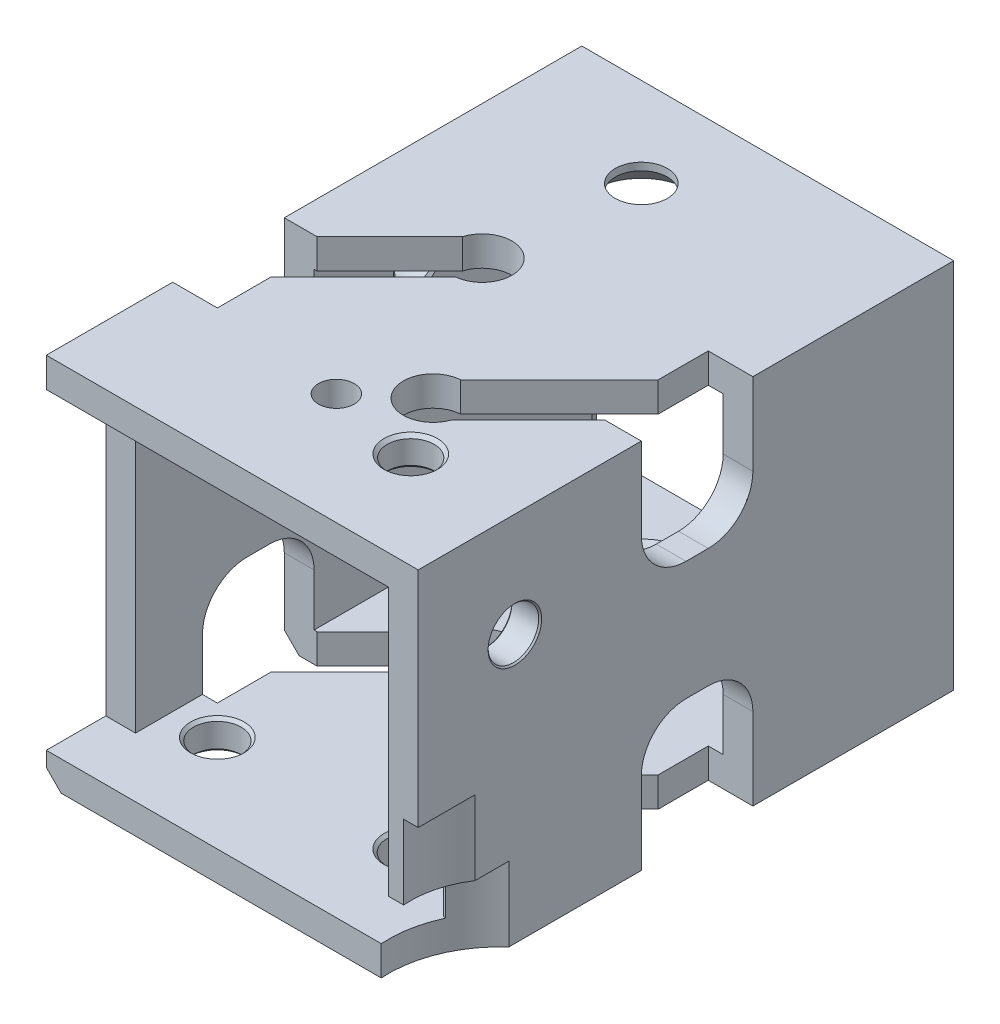
from build123d import *

# Parameters (mm, degrees)
SKETCH_1_W                   = 25
SKETCH_1_H                   = 25
SKETCH_1_W_2                 = 21
SKETCH_1_H_2                 = 21
EXTRUDE_1_DEPTH              = 36
SKETCH_11_R                  = 2
CUT_EXTRUDE_3_DEPTH          = 7
CUT_EXTRUDE_START            = -19
SKETCH_11_3_R                = 2
CUT_EXTRUDE_11_DEPTH         = 32.457903246
CHAMFER_2_SIZE               = 1
CHAMFER_4_SIZE               = 1
CHAMFER_4_SIZE2              = 1.327044822
SKETCH_14_R                  = 7.5
CUT_EXTRUDE_6_DEPTH          = 5
CHAMFER_5_SIZE               = 0.5
CUT_EXTRUDE_8_DEPTH          = 50.497474683
HOLE_WIZARD_3_2_AT_2_COUNT   = 2
HOLE_WIZARD_3_2_AT_2_PITCH   = 13
HOLE_WIZARD_4_401_AT_2_COUNT = 2
HOLE_WIZARD_4_401_AT_2_PITCH = 16
CUT_EXTRUDE_13_DEPTH         = 3
CUT_EXTRUDE_14_DEPTH         = 3
SKETCH_25_R                  = 1.75
CUT_EXTRUDE_15_DEPTH         = 51.457903246
SKETCH_26_R                  = 6
CUT_EXTRUDE_16_DEPTH         = 5
CHAMFER_6_SIZE               = 1.5


with BuildPart() as part:
    # Эскиз1 → Вытянуть1 (new body)
    with BuildSketch(Plane.XY):
        with Locations((12.5, 12.5)):
            Rectangle(SKETCH_1_W, SKETCH_1_H)
        with Locations((12.5, 12.5)):
            Rectangle(SKETCH_1_W_2, SKETCH_1_H_2, mode=Mode.SUBTRACT)
    extrude(amount=EXTRUDE_1_DEPTH)

    # Эскиз11 → Вырез-Вытянуть3 (cut)
    with BuildSketch(Plane(origin=(0, 25, 0), x_dir=(1, 0, 0), z_dir=(0, 1, 0))):
        with BuildLine():
            Line((25, -18.52949345), (25, -13.862588694))
            Line((25, -13.862588694), (15.357506109, -23.505082585))
            ThreePointArc((15.357506109, -23.505082585), (16.862903558, -24.03627397), (17.5, -25.5))
            ThreePointArc((17.5, -25.5), (17.47421651, -25.820108062), (17.397530829, -26.131962621))
            Line((17.397530829, -26.131962621), (25, -18.52949345))
        make_face()
        with BuildLine():
            Line((7.087167948, -15.115984981), (0, -22.203152929))
            Line((0, -22.203152929), (0, -26.870057685))
            Line((0, -26.870057685), (9.177993887, -17.692063798))
            ThreePointArc((9.177993887, -17.692063798), (7.447111922, -16.960372412), (7.087167948, -15.115984981))
        make_face()
        with Locations((9, -15.7)):
            Circle(SKETCH_11_R)
        with Locations((15.5, -25.5)):
            Circle(SKETCH_11_R)
    extrude(amount=-CUT_EXTRUDE_3_DEPTH, mode=Mode.SUBTRACT)

    # Эскиз11<3> → Вырез-Вытянуть11 (cut, through all)
    with BuildSketch(Plane(origin=(0, 25, 0), x_dir=(1, 0, 0), z_dir=(0, 1, 0)).offset(CUT_EXTRUDE_START)):
        with BuildLine():
            Line((25, -18.52949345), (25, -13.862588694))
            Line((25, -13.862588694), (15.357506109, -23.505082585))
            ThreePointArc((15.357506109, -23.505082585), (16.862903558, -24.03627397), (17.5, -25.5))
            ThreePointArc((17.5, -25.5), (17.47421651, -25.820108062), (17.397530829, -26.131962621))
            Line((17.397530829, -26.131962621), (25, -18.52949345))
        make_face()
        with Locations((15.5, -25.5)):
            Circle(SKETCH_11_3_R)
        with Locations((9, -15.7)):
            Circle(SKETCH_11_3_R)
        with BuildLine():
            Line((0, -22.203152929), (0, -26.870057685))
            Line((0, -26.870057685), (9.177993887, -17.692063798))
            ThreePointArc((9.177993887, -17.692063798), (7.447111922, -16.960372412), (7.087167948, -15.115984981))
            Line((7.087167948, -15.115984981), (0, -22.203152929))
        make_face()
    extrude(amount=-CUT_EXTRUDE_11_DEPTH, mode=Mode.SUBTRACT)

    # Отверстие с зазором M21: read off the stored shape, not the designer's step
    # Отверстие с зазором M21 outline → Отверстие с зазором M21 (revolve, cut)
    with BuildSketch(Plane(origin=(12, 0, 28.5), x_dir=(1, 0, 0), z_dir=(0, 0, 1))):
        Polygon((0, 23), (1.225, 23), (1.2, 23.025), (1.2, 25), (0, 25), align=None)
    revolve(axis=Axis((12, 0, 28.5), (0, 1, 0)), mode=Mode.SUBTRACT)

    # Фаска2
    chamfer_2_edges = [part.edges().sort_by_distance(p)[0] for p in [
        (0, 0, 31.435028843),
        (0, 0, 11.101576465),
    ]]
    chamfer(chamfer_2_edges, length=CHAMFER_2_SIZE)

    # Фаска4
    chamfer_4_edges = [part.edges().sort_by_distance(p)[0] for p in [
        (2, 12.5, 0),
    ]]
    chamfer_4_side = [part.faces().sort_by_distance(p)[0] for p in [
        (0.353553391, 13, 0),
    ]]
    chamfer(chamfer_4_edges, length=CHAMFER_4_SIZE, length2=CHAMFER_4_SIZE2, reference=chamfer_4_side[0])

    # Эскиз14 → Вырез-Вытянуть6 (cut)
    with BuildSketch(Plane.XZ):
        with Locations((30, 35.5)):
            Circle(SKETCH_14_R)
    extrude(amount=-CUT_EXTRUDE_6_DEPTH, mode=Mode.SUBTRACT)

    # Фаска5
    # the kernel refuses this chamfer: 0.5 mm, written as the material it takes off along each edge
    with BuildSketch(Plane(origin=(23, 5, 32.807417596), x_dir=(0, 0, -1), z_dir=(0, -1, 0))) as chamfer_5_piece_1:
        with BuildLine():
            Line((CHAMFER_5_SIZE, 0), (0.463529248, 0.196401008))
            ThreePointArc((0.463529248, 0.196401008), (0.235400494, 0.095152706), (0, 0))
            Line((0, 0), (CHAMFER_5_SIZE, 0))
        make_face()
    extrude(amount=3, mode=Mode.SUBTRACT)

    # Эскиз20 → Вырез-Вытянуть8 (cut, through all)
    with BuildSketch(Plane(origin=(2, 0, 0), x_dir=(0, 0, -1), z_dir=(1, 0, 0))):
        Polygon((-131.440037453, 23), (-36, 23), (-32, 23), (-32, 2), (-36, 2), (-131.440037453, 2), (-322.32011236, 2), (-322.32011236, 23), align=None)
    extrude(amount=-CUT_EXTRUDE_8_DEPTH, mode=Mode.SUBTRACT)

    # Эскиз15 → 3.2_для_отсека_кюветы (revolve, cut)
    with BuildSketch(Plane(origin=(5, 0, 29.5), x_dir=(0, 0, -1), z_dir=(1, 0, 0))):
        Polygon((0, 0), (0, 2), (1.8, 2), (1.6, 1.8), (1.6, 0.2), (1.8, 0), align=None)
    hole_wizard_3_2 = revolve(axis=Axis((5, -6.35, 29.5), (0, 1, 0)), mode=Mode.SUBTRACT)

    # 3.2_для_отсека_кюветы at 2: 3.2_для_отсека_кюветы ×2
    with Locations(*[(i * HOLE_WIZARD_3_2_AT_2_PITCH, 0, 0) for i in range(1, HOLE_WIZARD_3_2_AT_2_COUNT)]):
        add(hole_wizard_3_2, mode=Mode.SUBTRACT)

    # Эскиз17 → Отверстие обработанное метчиком #4-401 (revolve, cut)
    with BuildSketch(Plane(origin=(0, 20, 13), x_dir=(0, 0, 1), z_dir=(0, 1, 0))):
        Polygon((0, 0), (0, 2), (1.651, 2), (1.4224, 1.839932557), (1.4224, 0.160067443), (1.651, 0), align=None)
    hole_wizard_4_401 = revolve(axis=Axis((-6.35, 20, 13), (1, 0, 0)), mode=Mode.SUBTRACT)

    # Отверстие обработанное метчиком #4-401 at 2: Отверстие обработанное метчиком #4-401 ×2
    with Locations(*[(0, -i * HOLE_WIZARD_4_401_AT_2_PITCH, 0) for i in range(1, HOLE_WIZARD_4_401_AT_2_COUNT)]):
        add(hole_wizard_4_401, mode=Mode.SUBTRACT)

    # Эскиз23 → Вырез-Вытянуть13 (cut)
    with BuildSketch(Plane.ZY):
        with BuildLine():
            Line((20, 25), (20, 19.5))
            ThreePointArc((20, 19.5), (20.878679656, 17.378679656), (23, 16.5))
            Line((23, 16.5), (24.5, 16.5))
            ThreePointArc((24.5, 16.5), (26.621320344, 17.378679656), (27.5, 19.5))
            Line((27.5, 19.5), (27.5, 25))
            Line((27.5, 25), (20, 25))
        make_face()
        with BuildLine():
            Line((20, 5.5), (20, 0))
            Line((20, 0), (27.5, 0))
            Line((27.5, 0), (27.5, 5.5))
            ThreePointArc((27.5, 5.5), (26.621320344, 7.621320344), (24.5, 8.5))
            Line((24.5, 8.5), (23, 8.5))
            ThreePointArc((23, 8.5), (20.878679656, 7.621320344), (20, 5.5))
        make_face()
    extrude(amount=-CUT_EXTRUDE_13_DEPTH, mode=Mode.SUBTRACT)

    # Эскиз24 → Вырез-Вытянуть14 (cut)
    with BuildSketch(Plane(origin=(25, 0, 0), x_dir=(0, 0, -1), z_dir=(1, 0, 0))):
        with BuildLine():
            Line((-13.5, 25), (-13.5, 19.5))
            ThreePointArc((-13.5, 19.5), (-14.378679656, 17.378679656), (-16.5, 16.5))
            Line((-16.5, 16.5), (-18, 16.5))
            ThreePointArc((-18, 16.5), (-20.121320344, 17.378679656), (-21, 19.5))
            Line((-21, 19.5), (-21, 25))
            Line((-21, 25), (-13.5, 25))
        make_face()
        with BuildLine():
            Line((-13.5, 0), (-13.5, 5.5))
            ThreePointArc((-13.5, 5.5), (-14.378679656, 7.621320344), (-16.5, 8.5))
            Line((-16.5, 8.5), (-18, 8.5))
            ThreePointArc((-18, 8.5), (-20.121320344, 7.621320344), (-21, 5.5))
            Line((-21, 5.5), (-21, 0))
            Line((-21, 0), (-13.5, 0))
        make_face()
    extrude(amount=-CUT_EXTRUDE_14_DEPTH, mode=Mode.SUBTRACT)

    # Эскиз25 → Вырез-Вытянуть15 (cut, through all)
    with BuildSketch(Plane.XZ):
        with Locations(Location((10, 6, 0), (0, 0, 270))):
            Circle(SKETCH_25_R)
    extrude(amount=-CUT_EXTRUDE_15_DEPTH, mode=Mode.SUBTRACT)

    # Эскиз26 → Вырез-Вытянуть16 (cut)
    with BuildSketch(Plane.XZ.offset(-5)):
        with Locations((30, 35.5)):
            Circle(SKETCH_26_R)
    extrude(amount=-CUT_EXTRUDE_16_DEPTH, mode=Mode.SUBTRACT)

    # Эскиз27 → Сверло под метчик  спиральное M31 (revolve, cut)
    with BuildSketch(Plane(origin=(18, 25, 29.5), x_dir=(0, 0, 1), z_dir=(1, 0, 0))):
        Polygon((0, 0), (0, 2), (1.8, 2), (1.575, 1.775), (1.575, 0.225), (1.8, 0), align=None)
    revolve(axis=Axis((18, 31.35, 29.5), (0, -1, 0)), mode=Mode.SUBTRACT)

    # Фаска6
    chamfer_6_edges = [part.edges().sort_by_distance(p)[0] for p in [
        (10, 2, 7.75),
        (10, 23, 7.75),
    ]]
    chamfer(chamfer_6_edges, length=CHAMFER_6_SIZE)

    # Эскиз29 → Отверстие с зазором M32 (revolve, cut)
    with BuildSketch(Plane(origin=(25, 18, 29.5), x_dir=(0, 0, -1), z_dir=(0, 1, 0))):
        Polygon((0, 0), (0, 2), (1.8, 2), (1.7, 1.9), (1.7, 0.1), (1.8, 0), align=None)
    revolve(axis=Axis((31.35, 18, 29.5), (-1, 0, 0)), mode=Mode.SUBTRACT)


solid = part.part
